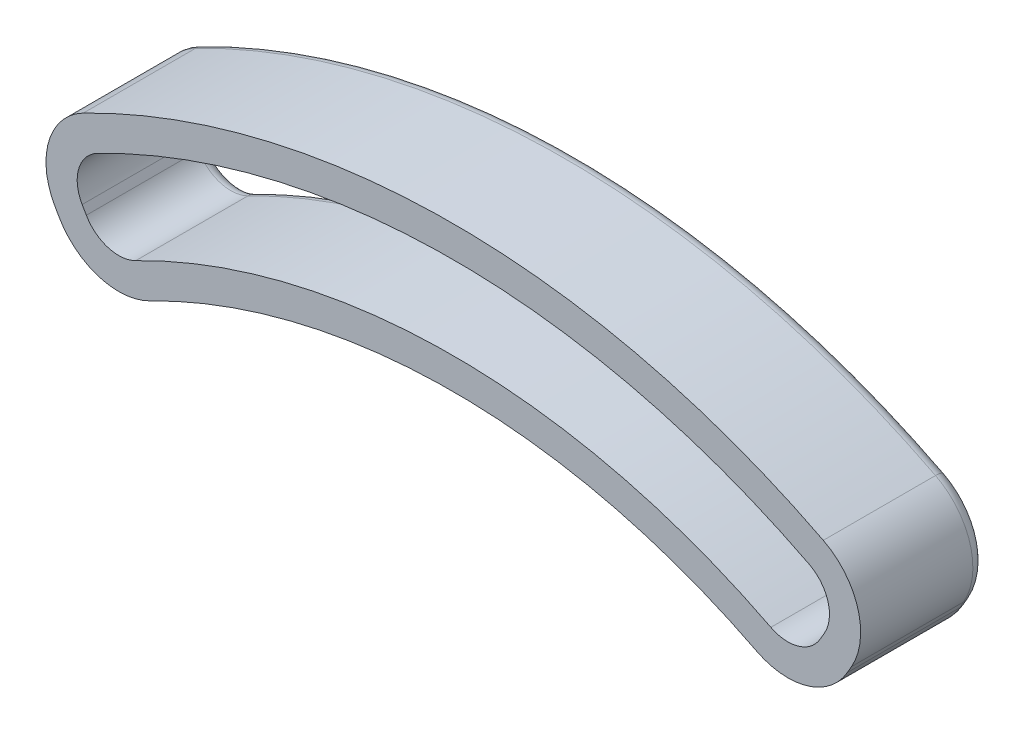
from build123d import *

# Parameters (mm, degrees)
EXTRUDE_THIN2_DEPTH = 7.62
FILLET2_R           = 0.762


with BuildPart() as part:
    # Sketch1 → Extrude-Thin2 (new body)
    with BuildSketch(Plane.XY):
        with BuildLine():
            Line((24.32799261, 38.327319246), (24.073666549, 37.886813588))
            ThreePointArc((24.073666549, 37.886813588), (21.631585853, 35.963049129), (18.536136228, 36.250832801))
            ThreePointArc((18.536136228, 36.250832801), (0, 40.715), (-18.536136228, 36.250832801))
            ThreePointArc((-18.536136228, 36.250832801), (-21.631585853, 35.963049129), (-24.073666549, 37.886813588))
            Line((-24.073666549, 37.886813588), (-24.32799261, 38.327319246))
            ThreePointArc((-24.32799261, 38.327319246), (-24.718082956, 41.60910514), (-22.608625258, 44.153211536))
            ThreePointArc((-22.608625258, 44.153211536), (0, 49.605), (22.608625258, 44.153211536))
            ThreePointArc((22.608625258, 44.153211536), (24.718082956, 41.60910514), (24.32799261, 38.327319246))
        make_face()
        with BuildLine():
            Line((22.678214215, 39.279819246), (22.423888155, 38.839313588))
            ThreePointArc((22.423888155, 38.839313588), (21.091844139, 37.78998752), (19.403417071, 37.946960431))
            ThreePointArc((19.403417071, 37.946960431), (0, 42.62), (-19.403417071, 37.946960431))
            ThreePointArc((-19.403417071, 37.946960431), (-21.091844139, 37.78998752), (-22.423888155, 38.839313588))
            Line((-22.423888155, 38.839313588), (-22.678214215, 39.279819246))
            ThreePointArc((-22.678214215, 39.279819246), (-22.890990768, 41.069884279), (-21.740377478, 42.457578677))
            ThreePointArc((-21.740377478, 42.457578677), (0, 47.7), (21.740377478, 42.457578677))
            ThreePointArc((21.740377478, 42.457578677), (22.890990768, 41.069884279), (22.678214215, 39.279819246))
        make_face(mode=Mode.SUBTRACT)
    extrude(amount=EXTRUDE_THIN2_DEPTH)

    # Fillet2
    fillet2_edges = [part.edges().sort_by_distance(p)[0] for p in [
        (22.890990768, 41.069884279, 0),
        (22.551051185, 39.059566417, 0),
        (21.091844139, 37.78998752, 0),
        (0, 42.62, 0),
        (-21.091844139, 37.78998752, 0),
        (-22.551051185, 39.059566417, 0),
        (-22.890990768, 41.069884279, 0),
        (24.718082956, 41.60910514, 0),
        (24.20082958, 38.107066417, 0),
        (21.631585853, 35.963049129, 0),
        (0, 40.715, 0),
        (-21.631585853, 35.963049129, 0),
        (-24.20082958, 38.107066417, 0),
        (-24.718082956, 41.60910514, 0),
        (0, 47.7, 0),
        (0, 49.605, 0),
    ]]
    fillet(fillet2_edges, radius=FILLET2_R)


solid = part.part
